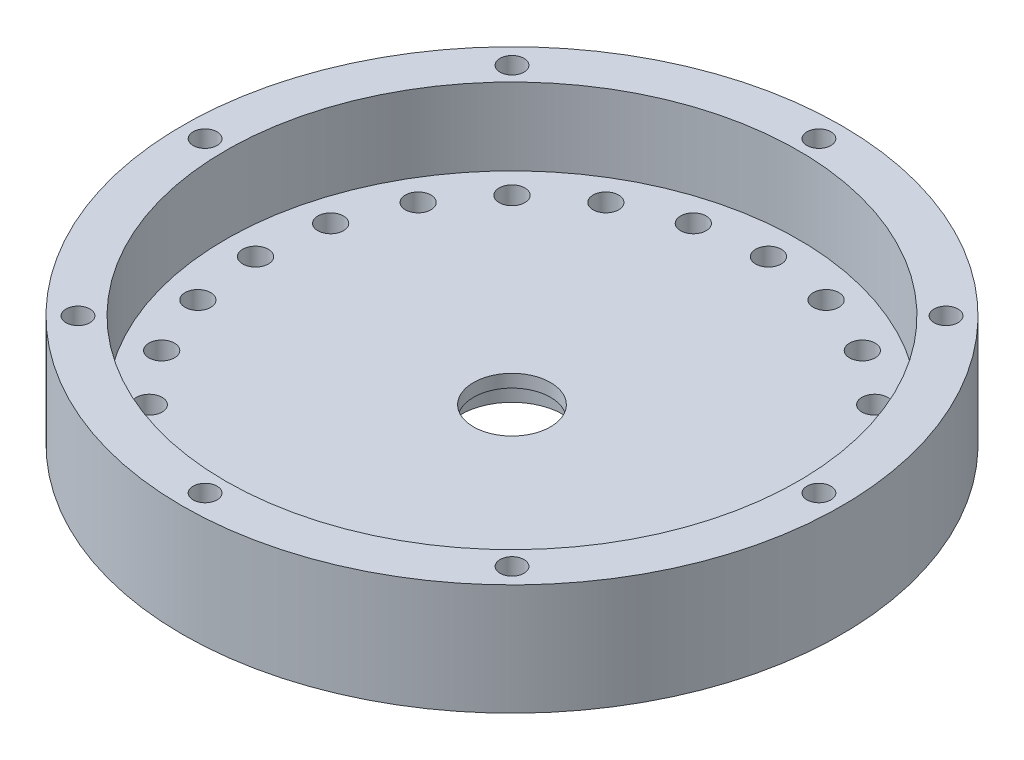
from build123d import *

# Parameters (mm, degrees)
SKETCH1_R           = 77.1
BOSS_EXTRUDE1_DEPTH = 26
SKETCH2_R           = 67
CUT_EXTRUDE1_DEPTH  = 18
SKETCH3_R           = 3
CUT_EXTRUDE2_DEPTH  = 5
SKETCH4_R           = 12
CUT_EXTRUDE3_DEPTH  = 5
SKETCH5_R           = 9
CUT_EXTRUDE4_DEPTH  = 5
SKETCH6_R           = 2.8
CUT_EXTRUDE5_DEPTH  = 8


with BuildPart() as part:
    # Sketch1 → Boss-Extrude1 (new body)
    with BuildSketch(Plane(origin=(0, 0, 0), x_dir=(1, 0, 0), z_dir=(0, 1, 0))):
        Circle(SKETCH1_R)
    extrude(amount=BOSS_EXTRUDE1_DEPTH)

    # Sketch2 → Cut-Extrude1 (cut)
    with BuildSketch(Plane(origin=(0, 26, 0), x_dir=(1, 0, 0), z_dir=(0, 1, 0))):
        Circle(SKETCH2_R)
    extrude(amount=-CUT_EXTRUDE1_DEPTH, mode=Mode.SUBTRACT)

    # Sketch3 → Cut-Extrude2 (cut)
    with BuildSketch(Plane(origin=(0, 8, 0), x_dir=(1, 0, 0), z_dir=(0, 1, 0))):
        with Locations((60, 0)):
            Circle(SKETCH3_R)
        with Locations((57.955549577, -15.529142706)):
            Circle(SKETCH3_R)
        with Locations((51.961524227, -30)):
            Circle(SKETCH3_R)
        with Locations((42.426406871, -42.426406871)):
            Circle(SKETCH3_R)
        with Locations((30, -51.961524227)):
            Circle(SKETCH3_R)
        with Locations((15.529142706, -57.955549577)):
            Circle(SKETCH3_R)
        with Locations((0, -60)):
            Circle(SKETCH3_R)
        with Locations((-15.529142706, -57.955549577)):
            Circle(SKETCH3_R)
        with Locations((-30, -51.961524227)):
            Circle(SKETCH3_R)
        with Locations((-42.426406871, -42.426406871)):
            Circle(SKETCH3_R)
        with Locations((-51.961524227, -30)):
            Circle(SKETCH3_R)
        with Locations((-57.955549577, -15.529142706)):
            Circle(SKETCH3_R)
        with Locations((-60, 0)):
            Circle(SKETCH3_R)
        with Locations((-57.955549577, 15.529142706)):
            Circle(SKETCH3_R)
        with Locations((-51.961524227, 30)):
            Circle(SKETCH3_R)
        with Locations((-42.426406871, 42.426406871)):
            Circle(SKETCH3_R)
        with Locations((-30, 51.961524227)):
            Circle(SKETCH3_R)
        with Locations((-15.529142706, 57.955549577)):
            Circle(SKETCH3_R)
        with Locations((0, 60)):
            Circle(SKETCH3_R)
        with Locations((15.529142706, 57.955549577)):
            Circle(SKETCH3_R)
        with Locations((30, 51.961524227)):
            Circle(SKETCH3_R)
        with Locations((42.426406871, 42.426406871)):
            Circle(SKETCH3_R)
        with Locations((51.961524227, 30)):
            Circle(SKETCH3_R)
        with Locations((57.955549577, 15.529142706)):
            Circle(SKETCH3_R)
    extrude(amount=-CUT_EXTRUDE2_DEPTH, mode=Mode.SUBTRACT)

    # Sketch4 → Cut-Extrude3 (cut)
    with BuildSketch(Plane.XZ):
        Circle(SKETCH4_R)
    extrude(amount=-CUT_EXTRUDE3_DEPTH, mode=Mode.SUBTRACT)

    # Sketch5 → Cut-Extrude4 (cut)
    with BuildSketch(Plane(origin=(0, 8, 0), x_dir=(1, 0, 0), z_dir=(0, 1, 0))):
        Circle(SKETCH5_R)
    extrude(amount=-CUT_EXTRUDE4_DEPTH, mode=Mode.SUBTRACT)

    # Sketch6 → Cut-Extrude5 (cut)
    with BuildSketch(Plane(origin=(0, 26, 0), x_dir=(1, 0, 0), z_dir=(0, 1, 0))):
        with Locations((0, 71.8)):
            Circle(SKETCH6_R)
        with Locations((50.770266889, 50.770266889)):
            Circle(SKETCH6_R)
        with Locations((71.8, 0)):
            Circle(SKETCH6_R)
        with Locations((50.770266889, -50.770266889)):
            Circle(SKETCH6_R)
        with Locations((0, -71.8)):
            Circle(SKETCH6_R)
        with Locations((-50.770266889, -50.770266889)):
            Circle(SKETCH6_R)
        with Locations((-71.8, 0)):
            Circle(SKETCH6_R)
        with Locations((-50.770266889, 50.770266889)):
            Circle(SKETCH6_R)
    extrude(amount=-CUT_EXTRUDE5_DEPTH, mode=Mode.SUBTRACT)


solid = part.part
